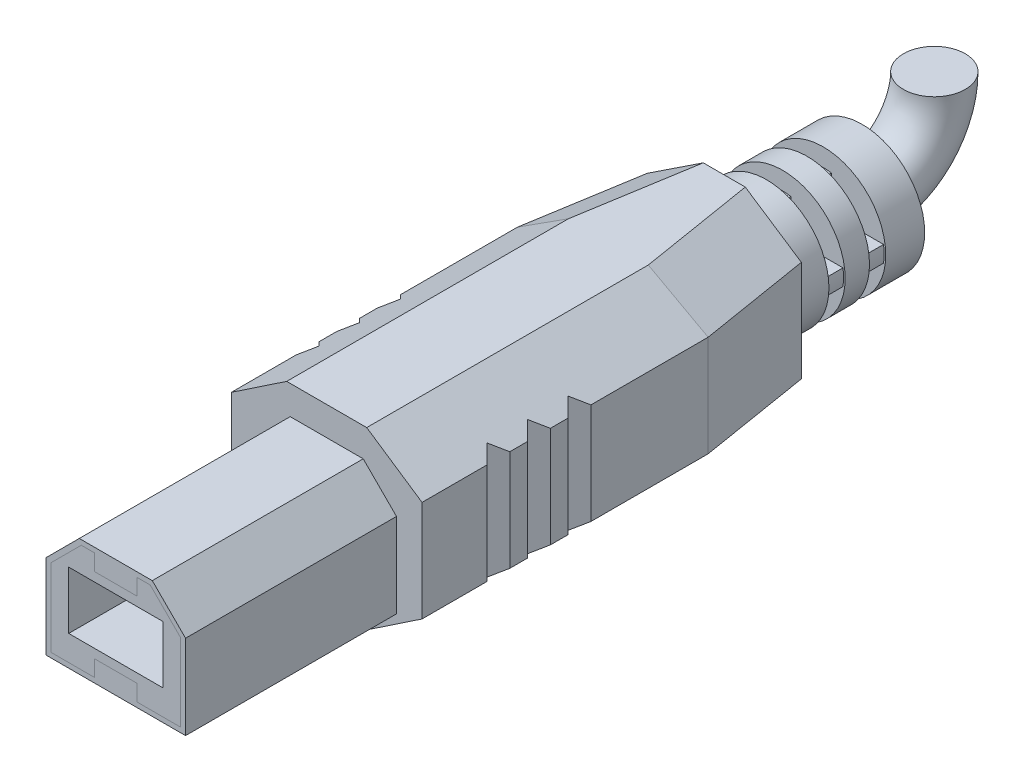
from build123d import *

# Parameters (mm, degrees)
SKETCH1_W           = 1.3
SKETCH1_H           = 0.555
BOSS_EXTRUDE1_DEPTH = 13
SKETCH3_W           = 2.9
SKETCH3_H           = 1.77
BOSS_EXTRUDE2_DEPTH = 24.5
CUT_EXTRUDE1_DEPTH  = 40.015589833
CHAMFER1_SIZE       = 3.41
CHAMFER1_SIZE_2     = 2.287970931
SKETCH7_W           = 3.85
SKETCH7_H           = 2.6
SKETCH7_H_2         = 1.5
SKETCH7_H_3         = 2.4
BOSS_EXTRUDE3_DEPTH = 6.25
SKETCH8_R           = 1.905
REVOLVE2_ANGLE      = 90


with BuildPart() as part:
    # Sketch1 → Boss-Extrude1 (new body)
    with BuildSketch(Plane.XY):
        Polygon((-1.3, 0.3), (-1.3, 1.3), (-1.3, 1.855), (-2.9, 1.855), (-2.9, 5.395), (-1.3, 5.395), (-1.3, 5.95), (-1.3, 6.95), (-2.125735931, 6.95), (-4, 5.075735931), (-4, 0.3), align=None)
        with Locations((-0.65, 1.5775)):
            Rectangle(SKETCH1_W, SKETCH1_H)
        Polygon((-4.3, 0), (0, 0), (0, 1.3), (-1.3, 1.3), (-1.3, 0.3), (-4, 0.3), (-4, 5.075735931), (-2.125735931, 6.95), (-1.3, 6.95), (-1.3, 5.95), (0, 5.95), (0, 7.25), (-2.25, 7.25), (-4.3, 5.2), align=None)
        with Locations((-0.65, 5.6725)):
            Rectangle(SKETCH1_W, SKETCH1_H)
    extrude(amount=-BOSS_EXTRUDE1_DEPTH)

    # Mirror1: part across plane


with BuildPart() as part_1:
    add(part.part)
    add(part.part.mirror(Plane(origin=(0, 0, -13), x_dir=(0, 0, 1), z_dir=(-1, 0, 0))))

    # Sketch3 → Boss-Extrude2 (add)
    with BuildSketch(Plane(origin=(0, 0, -13), x_dir=(-1, 0, 0), z_dir=(0, 0, -1))):
        with Locations((1.45, 4.51)):
            Rectangle(SKETCH3_W, SKETCH3_H)
        Polygon((2.25, 7.25), (0, 7.25), (0, 5.395), (2.9, 5.395), (2.9, 3.625), (4.3, 3.625), (4.3, 5.2), align=None)
        Polygon((3.043750454, 9.025), (0, 9.025), (0, 7.25), (2.25, 7.25), (4.3, 5.2), (4.3, 3.625), (5.875, 3.625), (5.875, 7.125), (5.875, 9.025), align=None)
    extrude(amount=BOSS_EXTRUDE2_DEPTH)

    # Sketch4 → Cut-Extrude1 (cut, through all)
    with BuildSketch(Plane(origin=(0, 9.025, 0), x_dir=(1, 0, 0), z_dir=(0, 1, 0))):
        Polygon((-4.75, 37.5), (-5.875, 30.63), (-5.875, 37.5), align=None)
        Polygon((-5.875, 23.407106781), (-5.167893219, 22.7), (-5.875, 21.992893219), align=None)
        Polygon((-5.167893219, 20.2), (-5.875, 19.492893219), (-5.875, 20.907106781), align=None)
        Polygon((-5.167893219, 17.7), (-5.875, 16.992893219), (-5.875, 18.407106781), align=None)
    extrude(amount=-CUT_EXTRUDE1_DEPTH, mode=Mode.SUBTRACT)

    # Chamfer1
    # the kernel refuses this chamfer: 3.41, 2.287970931 mm, written as the material it takes off along each edge
    with BuildSketch(Plane(origin=(-5.875, 9.025, -4.189784247), x_dir=(0.9997674455612761, 0.021565129164482656, 0), z_dir=(0, 0, -1))) as chamfer1_piece_1:
        Polygon((CHAMFER1_SIZE * 0.999767445561, CHAMFER1_SIZE * 0.0215651291645), (-CHAMFER1_SIZE_2 * 0.0215651291646, CHAMFER1_SIZE_2 * 0.999767445568), (0, 0), align=None)
    extrude(amount=21.613324726, mode=Mode.SUBTRACT)
    with BuildSketch(Plane(origin=(-5.875, 9.025, -14.596891028), x_dir=(0.9997674455612761, 0.021565129164482656, 0), z_dir=(0, 0, -1))) as chamfer1_piece_2:
        Polygon((CHAMFER1_SIZE * 0.999767445561, CHAMFER1_SIZE * 0.0215651291645), (-CHAMFER1_SIZE_2 * 0.0215651291646, CHAMFER1_SIZE_2 * 0.999767445568), (0, 0), align=None)
    extrude(amount=24.843324726, mode=Mode.SUBTRACT)
    with BuildSketch(Plane(origin=(-3.326242426, 9.025, -46.194412918), x_dir=(0.986626348001283, 0.021565129164482656, 0.1615654500002101), z_dir=(-0.16160303150249725, 0, 0.9868558457085832))) as chamfer1_piece_3:
        Polygon((CHAMFER1_SIZE * 0.999767445561, -CHAMFER1_SIZE * 0.0215651291645), (-CHAMFER1_SIZE_2 * 0.0215651291646, -CHAMFER1_SIZE_2 * 0.999767445568), (0, 0), align=None)
    extrude(amount=24.581934577, mode=Mode.SUBTRACT)


with BuildPart() as body_2:
    # Split1: the piece on the far side of the plane
    add(part_1.part)
    split(bisect_by=Plane.XY.offset(-13), keep=Keep.BOTTOM)

    # Mirror9: body 2 across plane


with BuildPart() as part_2:
    add(part_1.part)

    # Split1
    split(bisect_by=Plane.XY.offset(-13), keep=Keep.TOP)


with BuildPart() as body_2_1:
    add(body_2.part)
    add(body_2.part.mirror(Plane(origin=(0, 0, -37.5), x_dir=(0, 0, 1), z_dir=(-1, 0, 0))))

    # Mirror10: body 2 across plane


with BuildPart() as body_2_2:
    add(body_2_1.part)
    add(body_2_1.part.mirror(Plane(origin=(0, 3.625, -37.5), x_dir=(0, 0, 1), z_dir=(0, 1, 0))))

    # Combine1: union part
    add(part_2.part)

    # Sketch7 → Revolve1 (revolve)
    with BuildSketch(Plane(origin=(0, 3.625, 0), x_dir=(1, 0, 0), z_dir=(0, 1, 0))):
        with Locations((1.925, 38.8)):
            Rectangle(SKETCH7_W, SKETCH7_H)
        with Locations((1.925, 41.85)):
            Rectangle(SKETCH7_W, SKETCH7_H_2)
        with Locations((1.925, 44.8)):
            Rectangle(SKETCH7_W, SKETCH7_H_3)
    revolve(axis=Axis((0, 3.625, -43.6), (0, 0, -1)))


with BuildPart() as revolve1_piece_1:
    # of the separate pieces the step leaves, piece 1, a body of its own (revolve1_pieces)
    add(body_2_2.part.solids().sort_by_distance((-5.875, 6.737029069, -13))[0])

    # Sketch5 → Boss-Extrude3 (add)
    with BuildSketch(Plane(origin=(0, 0, -37.5), x_dir=(-1, 0, 0), z_dir=(0, 0, -1))):
        with BuildLine():
            Line((-0.5, 6.329163457), (-0.5, 4.125))
            Line((-0.5, 4.125), (-3.716517187, 4.125))
            ThreePointArc((-3.716517187, 4.125), (-3.75, 3.625), (-3.716517187, 3.125))
            Line((-3.716517187, 3.125), (-0.5, 3.125))
            Line((-0.5, 3.125), (-0.5, 0.920836543))
            ThreePointArc((-0.5, 0.920836543), (0, 0.875), (0.5, 0.920836543))
            Line((0.5, 0.920836543), (0.5, 3.125))
            Line((0.5, 3.125), (3.716517187, 3.125))
            ThreePointArc((3.716517187, 3.125), (3.75, 3.625), (3.716517187, 4.125))
            Line((3.716517187, 4.125), (0.5, 4.125))
            Line((0.5, 4.125), (0.5, 6.329163457))
            ThreePointArc((0.5, 6.329163457), (0, 6.375), (-0.5, 6.329163457))
        make_face()
    extrude(amount=BOSS_EXTRUDE3_DEPTH)


with BuildPart() as revolve1_piece_2:
    # of the separate pieces the step leaves, piece 2, a body of its own (revolve1_pieces)
    add(body_2_2.part.solids().sort_by_distance((3.85, 3.625, -43.6))[0])

    # Sketch8 → Revolve2 (revolve)
    with BuildSketch(Plane(origin=(0, 0, -46), x_dir=(-1, 0, 0), z_dir=(0, 0, -1))):
        with Locations((0, 3.625)):
            Circle(SKETCH8_R)
    revolve(axis=Axis((4.502336245, 8.07, -46), (1, 0, 0)), revolution_arc=REVOLVE2_ANGLE)


with BuildPart() as revolve1_piece_3:
    # of the separate pieces the step leaves, piece 3, a body of its own (revolve1_pieces)
    add(body_2_2.part.solids().sort_by_distance((3.85, 3.625, -41.1))[0])


solid = Compound([revolve1_piece_1.part, revolve1_piece_2.part, revolve1_piece_3.part])
